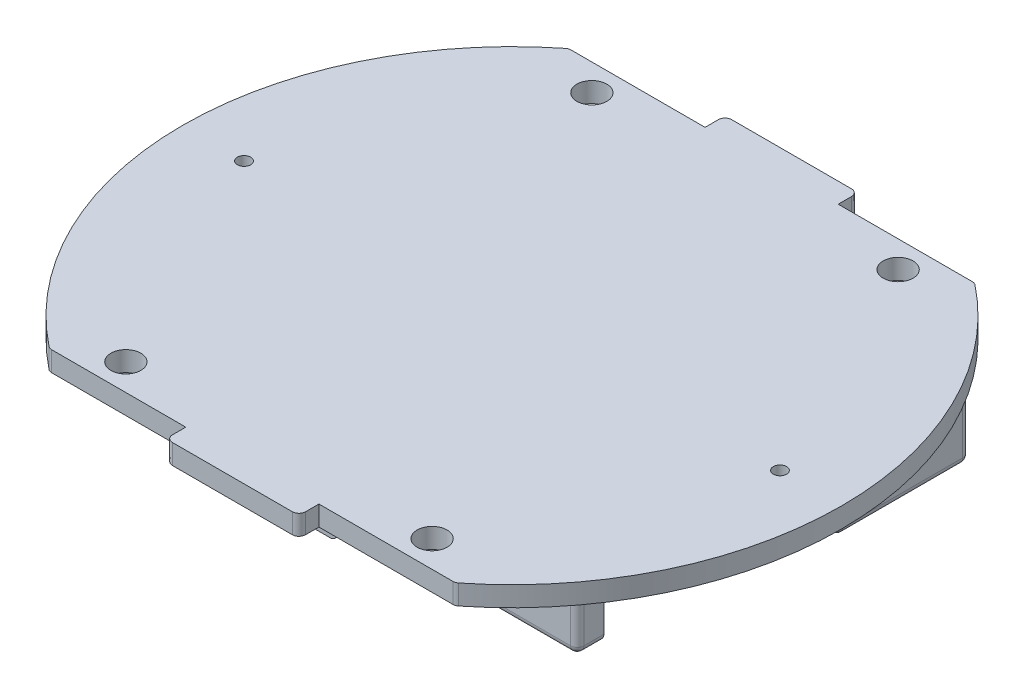
from build123d import *

# Parameters (mm, degrees)
A_BASE_T42_OUTLINE_R       = 2.2479
A_BASE_T42_OUTLINE_R_2     = 1
A_BASE_T42_DEPTH           = 3
OUTER_RIM_CUT_DEPTH        = 68.299702823
SKETCH2_W                  = 20
SKETCH2_H                  = 3
FLANGES_DEPTH              = 3
CONTOURING_R               = 1
SKETCH3_W                  = 15
SKETCH3_H                  = 3
BASE_SUPPORTS_DEPTH        = 3
BASE_SUPPORTS_CHAMFER_SIZE = 3
SKETCH10_W                 = 15
SKETCH10_H                 = 6
CUT_EXTRUDE1_DEPTH         = 10
SKETCH9_W                  = 10
SKETCH9_H                  = 10
BOSS_EXTRUDE1_DEPTH        = 4.6
BOSS_EXTRUDE2_DEPTH        = 10.6
FILLET1_R                  = 1


# Read off the part's stored shape, not the designer's step: a_base_t42
with BuildPart() as part:
    # a_base_t42 outline → a_base_t42 (new body)
    with BuildSketch(Plane(origin=(0, 0, 0), x_dir=(1, 0, 0), z_dir=(0, 1, 0))):
        with BuildLine():
            ThreePointArc((31.5, -42), (52.5, 0), (31.5, 42))
            Line((31.5, 42), (-31.5, 42))
            ThreePointArc((-31.5, 42), (-52.5, 0), (-31.5, -42))
            Line((-31.5, -42), (31.5, -42))
        make_face()
        with Locations((-23, -35)):
            Circle(A_BASE_T42_OUTLINE_R, mode=Mode.SUBTRACT)
        with Locations((23, -35)):
            Circle(A_BASE_T42_OUTLINE_R, mode=Mode.SUBTRACT)
        with Locations((-40.25, 0)):
            Circle(A_BASE_T42_OUTLINE_R_2, mode=Mode.SUBTRACT)
        with Locations((-23, 35)):
            Circle(A_BASE_T42_OUTLINE_R, mode=Mode.SUBTRACT)
        with Locations((40.25, 0)):
            Circle(A_BASE_T42_OUTLINE_R_2, mode=Mode.SUBTRACT)
        with Locations((23, 35)):
            Circle(A_BASE_T42_OUTLINE_R, mode=Mode.SUBTRACT)
    extrude(amount=A_BASE_T42_DEPTH)

    # Sketch1 → Outer Rim Cut (cut, through all)
    with BuildSketch(Plane.XZ):
        with BuildLine():
            Line((31.5, 42), (-31.5, 42))
            ThreePointArc((-31.5, 42), (-52.5, 0), (-31.5, -42))
            Line((-31.5, -42), (31.5, -42))
            ThreePointArc((31.5, -42), (52.5, 0), (31.5, 42))
        make_face()
        with BuildLine():
            Line((30.483602149, 39), (-30.483602149, 39))
            ThreePointArc((-30.483602149, 39), (-49.5, 0), (-30.483602149, -39))
            Line((-30.483602149, -39), (30.483602149, -39))
            ThreePointArc((30.483602149, -39), (49.5, 0), (30.483602149, 39))
        make_face(mode=Mode.SUBTRACT)
    extrude(amount=-OUTER_RIM_CUT_DEPTH, mode=Mode.SUBTRACT)

    # Sketch2 → Flanges (add)
    with BuildSketch(Plane.XZ):
        with Locations((0, -40.5)):
            Rectangle(SKETCH2_W, SKETCH2_H)
        with Locations((0, 40.5)):
            Rectangle(SKETCH2_W, SKETCH2_H)
    extrude(amount=-FLANGES_DEPTH)

    # Contouring
    contouring_edges = [part.edges().sort_by_distance(p)[0] for p in [
        (30.483602149, 1.5, -39),
        (-30.483602149, 1.5, -39),
        (10, 1.5, -42),
        (-10, 1.5, -42),
        (30.483602149, 1.5, 39),
        (-30.483602149, 1.5, 39),
        (10, 1.5, 42),
        (-10, 1.5, 42),
    ]]
    fillet(contouring_edges, radius=CONTOURING_R)

    # Sketch3 → Base Supports (add)
    with BuildSketch(Plane.XZ):
        with Locations((0, -27)):
            Rectangle(SKETCH3_W, SKETCH3_H)
        with Locations((0, 27)):
            Rectangle(SKETCH3_W, SKETCH3_H)
    extrude(amount=BASE_SUPPORTS_DEPTH)

    # Base Supports Chamfer
    base_supports_chamfer_edges = [part.edges().sort_by_distance(p)[0] for p in [
        (0, 0, 28.5),
        (0, 0, -28.5),
    ]]
    chamfer(base_supports_chamfer_edges, length=BASE_SUPPORTS_CHAMFER_SIZE - 0.0001)  # a hair under: the kernel refuses the full size

    # Sketch10 → Cut-Extrude1 (cut)
    with BuildSketch(Plane.XZ):
        with Locations((0, 28.5)):
            Rectangle(SKETCH10_W, SKETCH10_H)
        with Locations((0, -28.5)):
            Rectangle(SKETCH10_W, SKETCH10_H)
    extrude(amount=CUT_EXTRUDE1_DEPTH, mode=Mode.SUBTRACT)

    # Sketch9 → Boss-Extrude1 (add)
    with BuildSketch(Plane.XZ):
        with Locations((6.35, 16.95)):
            Rectangle(SKETCH9_W, SKETCH9_H)
        with Locations((30.75, 16.95)):
            Rectangle(SKETCH9_W, SKETCH9_H)
        with Locations((30.75, -19.95)):
            Rectangle(SKETCH9_W, SKETCH9_H)
        with Locations((6.35, -19.95)):
            Rectangle(SKETCH9_W, SKETCH9_H)
        with Locations((-6.35, -16.95)):
            Rectangle(SKETCH9_W, SKETCH9_H)
        with Locations((-6.35, 19.95)):
            Rectangle(SKETCH9_W, SKETCH9_H)
        with Locations((-30.75, 19.95)):
            Rectangle(SKETCH9_W, SKETCH9_H)
        with Locations((-30.75, -16.95)):
            Rectangle(SKETCH9_W, SKETCH9_H)
    extrude(amount=BOSS_EXTRUDE1_DEPTH)

    # Sketch11 → Boss-Extrude2 (add)
    with BuildSketch(Plane.XZ):
        Polygon((35.75, -24.95), (35.75, -8.95), (39.75, -8.95), (39.75, -28.95), (25.75, -28.95), (25.75, -24.95), align=None)
        Polygon((-2.65, -28.95), (-2.65, -25.95), (-35.75, -25.95), (-35.75, -21.95), (-1.35, -21.95), (-1.35, -9.95), (1.35, -9.95), (1.35, -24.95), (11.35, -24.95), (11.35, -28.95), align=None)
        Polygon((-1.35, 24.95), (-11.35, 24.95), (-11.35, 28.95), (2.65, 28.95), (2.65, 25.95), (35.75, 25.95), (35.75, 21.95), (1.35, 21.95), (1.35, 9.95), (-1.35, 9.95), align=None)
        Polygon((-35.75, 24.95), (-35.75, 8.95), (-39.75, 8.95), (-39.75, 28.95), (-25.75, 28.95), (-25.75, 24.95), align=None)
    extrude(amount=BOSS_EXTRUDE2_DEPTH)

    # Fillet1
    fillet1_edges = [part.edges().sort_by_distance(p)[0] for p in [
        (2.65, -10.6, 27.45),
        (-2.65, -10.6, -27.45),
        (2.65, -5.3, 25.95),
        (-39.75, -5.3, 28.95),
        (-39.75, -5.3, 8.95),
        (-1.35, -2.3, 14.95),
        (-11.35, -2.3, 14.95),
        (-25.75, -2.3, 14.95),
        (-35.75, -2.3, 14.95),
        (-1.35, -2.3, -11.95),
        (-11.35, -2.3, -21.95),
        (-11.35, -2.3, -11.95),
        (-25.75, -2.3, -21.95),
        (35.75, -2.3, 11.95),
        (-35.75, -2.3, -11.95),
        (-25.75, -2.3, -11.95),
        (-35.75, -10.6, -23.95),
        (39.75, -10.6, -18.95),
        (37.75, -10.6, -8.95),
        (35.75, -10.6, 23.95),
        (19.2, -10.6, 25.95),
        (35.75, -5.3, 25.95),
        (25.75, -2.3, 11.95),
        (25.75, -2.3, 21.95),
        (11.35, -2.3, 21.95),
        (1.35, -2.3, 11.95),
        (11.35, -2.3, 11.95),
        (-1.35, -5.3, 9.95),
        (1.35, -5.3, 9.95),
        (1.35, -5.3, -9.95),
        (-1.35, -5.3, -9.95),
        (1.35, -2.3, -14.95),
        (11.35, -2.3, -14.95),
        (25.75, -2.3, -14.95),
        (35.75, -2.3, -14.95),
        (39.75, -5.3, -8.95),
        (39.75, -5.3, -28.95),
        (32.75, -10.6, -28.95),
        (-2.65, -5.3, -25.95),
        (-19.2, -10.6, -25.95),
        (-39.75, -10.6, 18.95),
        (-32.75, -10.6, 28.95),
        (-11.35, -5.3, 28.95),
        (-25.75, -5.3, 28.95),
        (11.35, -5.3, -28.95),
        (25.75, -5.3, -28.95),
    ]]
    fillet(fillet1_edges, radius=FILLET1_R - 0.0001)  # a hair under: the kernel refuses the full size


solid = part.part
